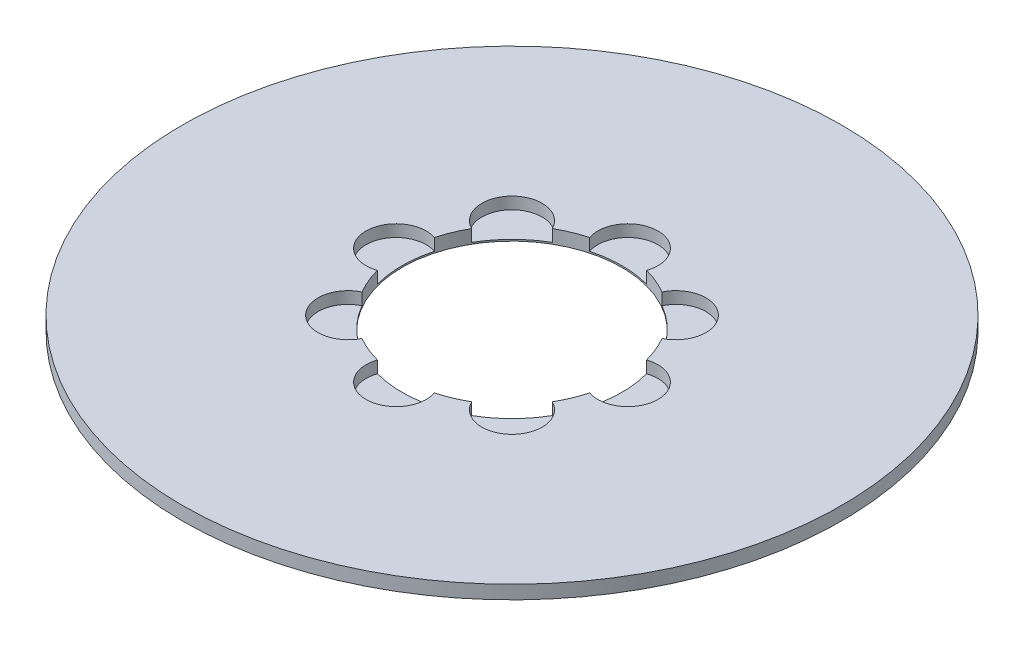
from build123d import *

# Parameters (mm, degrees)
SKETCH1_R           = 97.5
BOSS_EXTRUDE1_DEPTH = 4
SKETCH2_R           = 32.5
CUT_EXTRUDE1_DEPTH  = 138.943829148
SKETCH3_R           = 8.905291888
CUT_EXTRUDE2_DEPTH  = 3.531328283
CIRPATTERN1_COUNT   = 8


with BuildPart() as part:
    # Sketch1 → Boss-Extrude1 (new body)
    with BuildSketch(Plane(origin=(0, 0, 0), x_dir=(1, 0, 0), z_dir=(0, 1, 0))):
        Circle(SKETCH1_R)
    extrude(amount=BOSS_EXTRUDE1_DEPTH)

    # Sketch2 → Cut-Extrude1 (cut, through all)
    with BuildSketch(Plane(origin=(0, 0, 0), x_dir=(1, 0, 0), z_dir=(0, 1, 0))):
        Circle(SKETCH2_R)
    extrude(amount=CUT_EXTRUDE1_DEPTH, mode=Mode.SUBTRACT)

    # Sketch3 → Cut-Extrude2 (cut)
    with BuildSketch(Plane(origin=(0, 4, 0), x_dir=(1, 0, 0), z_dir=(0, 1, 0))):
        with Locations((-34.277485056, 0)):
            Circle(SKETCH3_R)
    cut_extrude2 = extrude(amount=-CUT_EXTRUDE2_DEPTH, mode=Mode.SUBTRACT)

    # CirPattern1: Cut-Extrude2 ×8 about axis
    cirpattern1_axis = Axis((0, 0, 0), (0, 1, 0))
    for i in range(1, CIRPATTERN1_COUNT):
        add(cut_extrude2.rotate(cirpattern1_axis, i * 360 / CIRPATTERN1_COUNT), mode=Mode.SUBTRACT)


solid = part.part
